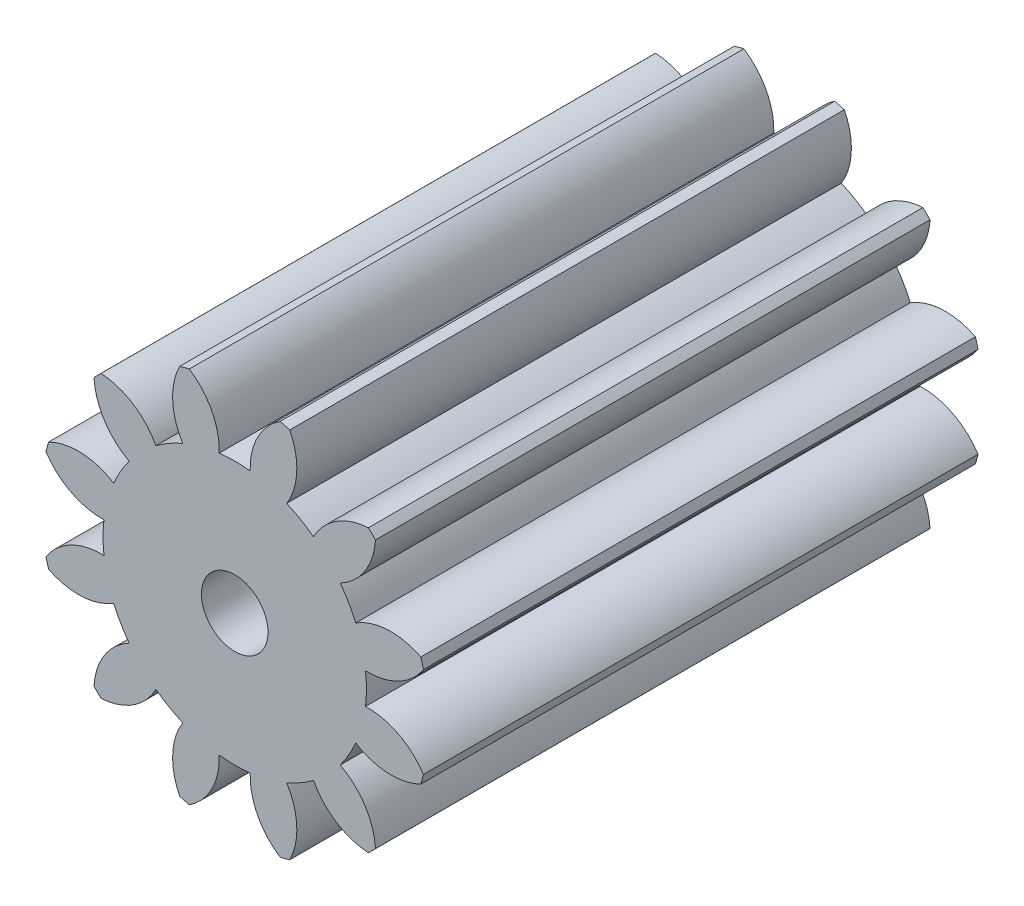
from build123d import *

# Parameters (mm, degrees)
SKETCH1_R           = 3
BOSS_EXTRUDE1_DEPTH = 50


with BuildPart() as part:
    # Sketch1 → Boss-Extrude1 (new body)
    with BuildSketch(Plane.XY):
        with BuildLine():
            ThreePointArc((-12.051706508, 12.688828561), (-12.374368671, 12.374368671), (-12.688828561, 12.051706508))
            ThreePointArc((-12.688828561, 12.051706508), (-11.749370601, 9.162245044), (-9.514845613, 7.103491322))
            ThreePointArc((-9.514845613, 7.103491322), (-10.283185645, 5.937), (-10.909226747, 4.688352353))
            ThreePointArc((-10.909226747, 4.688352353), (-13.809422264, 5.594130897), (-16.781498275, 4.962994624))
            ThreePointArc((-16.781498275, 4.962994624), (-16.90370196, 4.529333289), (-17.014701132, 4.092669715))
            ThreePointArc((-17.014701132, 4.092669715), (-14.756375941, 2.060051663), (-11.791843675, 1.394381134))
            ThreePointArc((-11.791843675, 1.394381134), (-11.874, 0), (-11.791843675, -1.394381134))
            ThreePointArc((-11.791843675, -1.394381134), (-14.756375941, -2.060051663), (-17.014701132, -4.092669715))
            ThreePointArc((-17.014701132, -4.092669715), (-16.90370196, -4.529333289), (-16.781498275, -4.962994624))
            ThreePointArc((-16.781498275, -4.962994624), (-13.809422264, -5.594130897), (-10.909226747, -4.688352353))
            ThreePointArc((-10.909226747, -4.688352353), (-10.283185645, -5.937), (-9.514845613, -7.103491322))
            ThreePointArc((-9.514845613, -7.103491322), (-11.749370601, -9.162245044), (-12.688828561, -12.051706508))
            ThreePointArc((-12.688828561, -12.051706508), (-12.374368671, -12.374368671), (-12.051706508, -12.688828561))
            ThreePointArc((-12.051706508, -12.688828561), (-9.162245044, -11.749370601), (-7.103491322, -9.514845613))
            ThreePointArc((-7.103491322, -9.514845613), (-5.937, -10.283185645), (-4.688352353, -10.909226747))
            ThreePointArc((-4.688352353, -10.909226747), (-5.594130897, -13.809422264), (-4.962994624, -16.781498275))
            ThreePointArc((-4.962994624, -16.781498275), (-4.529333289, -16.90370196), (-4.092669715, -17.014701132))
            ThreePointArc((-4.092669715, -17.014701132), (-2.060051663, -14.756375941), (-1.394381134, -11.791843675))
            ThreePointArc((-1.394381134, -11.791843675), (0, -11.874), (1.394381134, -11.791843675))
            ThreePointArc((1.394381134, -11.791843675), (2.060051663, -14.756375941), (4.092669715, -17.014701132))
            ThreePointArc((4.092669715, -17.014701132), (4.529333289, -16.90370196), (4.962994624, -16.781498275))
            ThreePointArc((4.962994624, -16.781498275), (5.594130897, -13.809422264), (4.688352353, -10.909226747))
            ThreePointArc((4.688352353, -10.909226747), (5.937, -10.283185645), (7.103491322, -9.514845613))
            ThreePointArc((7.103491322, -9.514845613), (9.162245044, -11.749370601), (12.051706508, -12.688828561))
            ThreePointArc((12.051706508, -12.688828561), (12.374368671, -12.374368671), (12.688828561, -12.051706508))
            ThreePointArc((12.688828561, -12.051706508), (11.749370601, -9.162245044), (9.514845613, -7.103491322))
            ThreePointArc((9.514845613, -7.103491322), (10.283185645, -5.937), (10.909226747, -4.688352353))
            ThreePointArc((10.909226747, -4.688352353), (13.809422264, -5.594130897), (16.781498275, -4.962994624))
            ThreePointArc((16.781498275, -4.962994624), (16.90370196, -4.529333289), (17.014701132, -4.092669715))
            ThreePointArc((17.014701132, -4.092669715), (14.756375941, -2.060051663), (11.791843675, -1.394381134))
            ThreePointArc((11.791843675, -1.394381134), (11.874, 0), (11.791843675, 1.394381134))
            ThreePointArc((11.791843675, 1.394381134), (14.756375941, 2.060051663), (17.014701132, 4.092669715))
            ThreePointArc((17.014701132, 4.092669715), (16.90370196, 4.529333289), (16.781498275, 4.962994624))
            ThreePointArc((16.781498275, 4.962994624), (13.809422264, 5.594130897), (10.909226747, 4.688352353))
            ThreePointArc((10.909226747, 4.688352353), (10.283185645, 5.937), (9.514845613, 7.103491322))
            ThreePointArc((9.514845613, 7.103491322), (11.749370601, 9.162245044), (12.688828561, 12.051706508))
            ThreePointArc((12.688828561, 12.051706508), (12.374368671, 12.374368671), (12.051706508, 12.688828561))
            ThreePointArc((12.051706508, 12.688828561), (9.162245044, 11.749370601), (7.103491322, 9.514845613))
            ThreePointArc((7.103491322, 9.514845613), (5.937, 10.283185645), (4.688352353, 10.909226747))
            ThreePointArc((4.688352353, 10.909226747), (5.594130897, 13.809422264), (4.962994624, 16.781498275))
            ThreePointArc((4.962994624, 16.781498275), (4.529333289, 16.90370196), (4.092669715, 17.014701132))
            ThreePointArc((4.092669715, 17.014701132), (2.060051663, 14.756375941), (1.394381134, 11.791843675))
            ThreePointArc((1.394381134, 11.791843675), (0, 11.874), (-1.394381134, 11.791843675))
            ThreePointArc((-1.394381134, 11.791843675), (-2.060051663, 14.756375941), (-4.092669715, 17.014701132))
            ThreePointArc((-4.092669715, 17.014701132), (-4.529333289, 16.90370196), (-4.962994624, 16.781498275))
            ThreePointArc((-4.962994624, 16.781498275), (-5.594130897, 13.809422264), (-4.688352353, 10.909226747))
            ThreePointArc((-4.688352353, 10.909226747), (-5.937, 10.283185645), (-7.103491322, 9.514845613))
            ThreePointArc((-7.103491322, 9.514845613), (-9.162245044, 11.749370601), (-12.051706508, 12.688828561))
        make_face()
        Circle(SKETCH1_R, mode=Mode.SUBTRACT)
    extrude(amount=BOSS_EXTRUDE1_DEPTH)


solid = part.part
